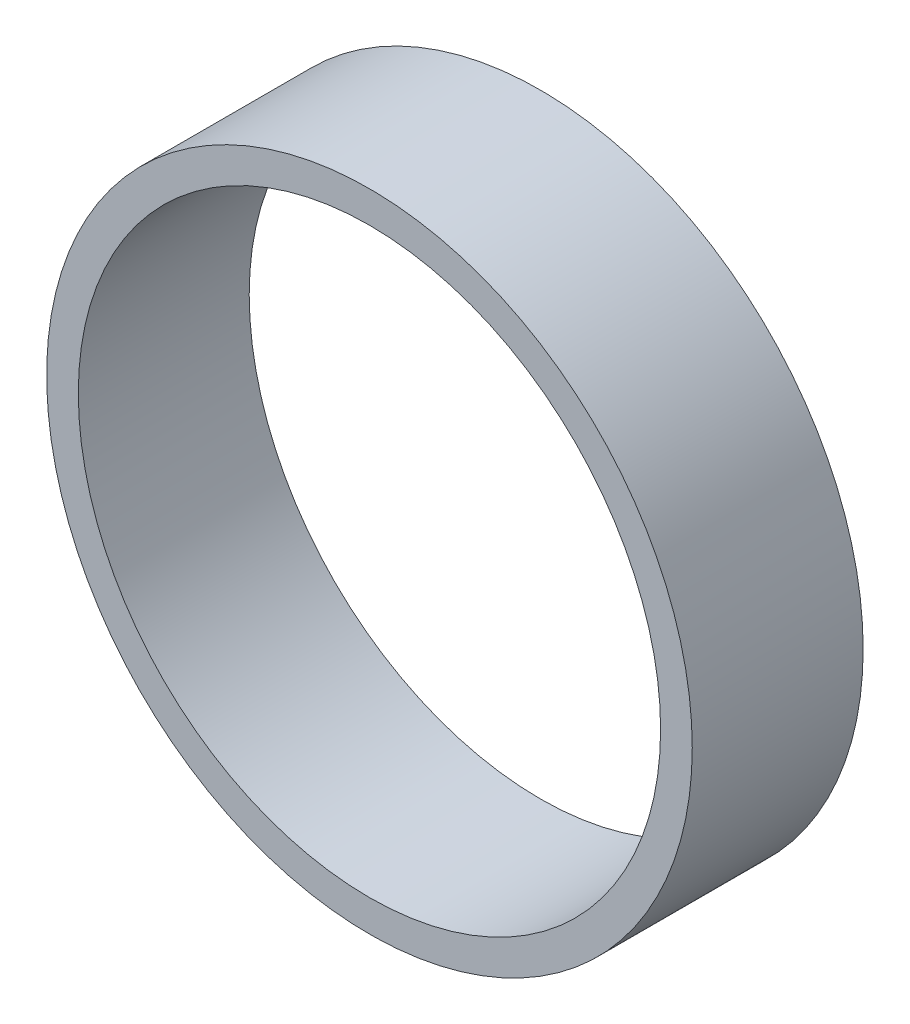
from build123d import *

# Parameters (mm, degrees)
SKETCH1_R           = 51
SKETCH1_R_2         = 46
BOSS_EXTRUDE1_DEPTH = 27


with BuildPart() as part:
    # Sketch1 → Boss-Extrude1 (new body)
    with BuildSketch(Plane.XY):
        Circle(SKETCH1_R)
        Circle(SKETCH1_R_2, mode=Mode.SUBTRACT)
    extrude(amount=BOSS_EXTRUDE1_DEPTH)


solid = part.part
